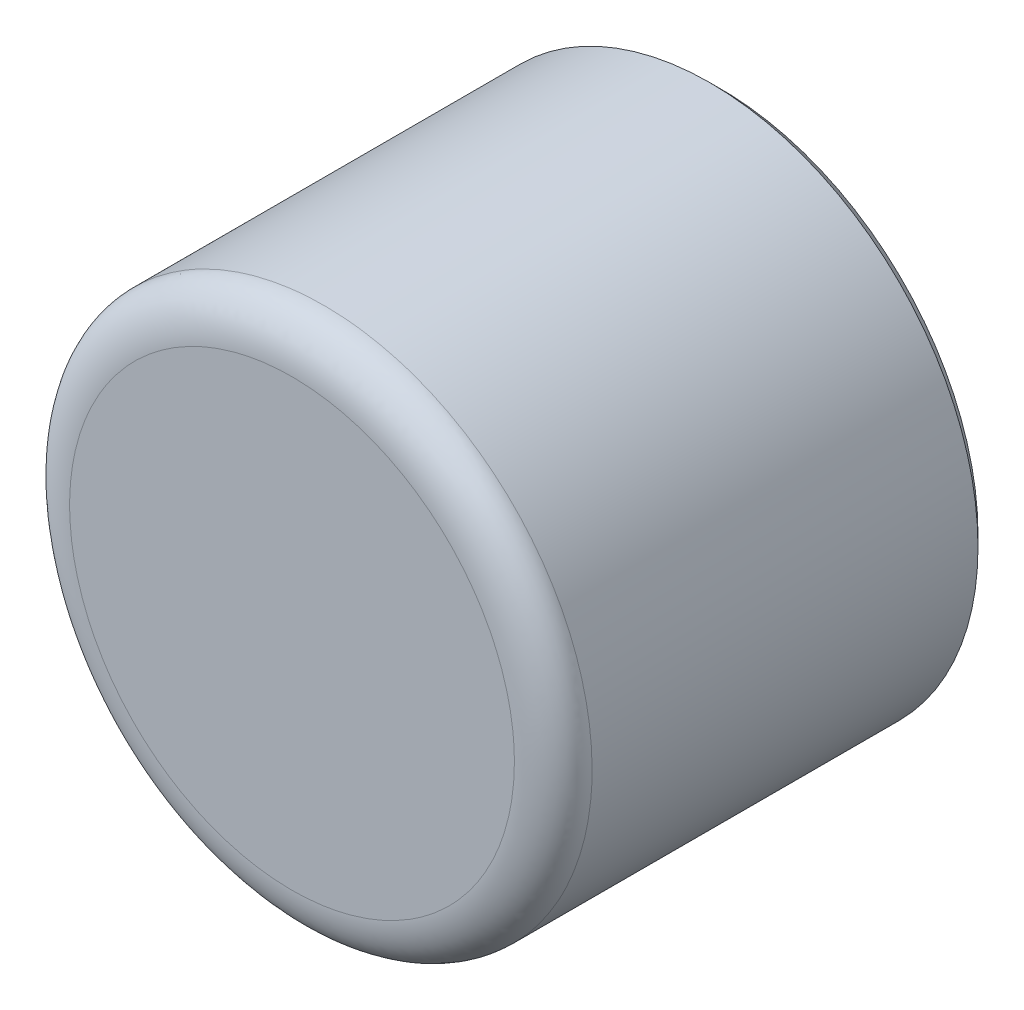
from build123d import *

# Parameters (mm, degrees)
SKETCH_1_R               = 10
EXTRUDE_1_DEPTH          = 16
FILLET_1_SIZE            = 1.2
FILLET_1_SIZE_2          = 1.7
SKETCH_2_R               = 3.15
CUT_EXTRUDE_1_DEPTH      = 11
EXTRUDE_2_REACH          = 23.354
PATTERN_CIRCULAR_1_COUNT = 18
SKETCH_4_R               = 8.5
SKETCH_4_R_2             = 4.5
CUT_EXTRUDE_2_DEPTH      = 14
FILLET_2_R               = 2
CHAMFER_1_SIZE           = 0.4
CHAMFER_2_SIZE           = 0.4


# Some blends are built 0.0001 mm under size
with BuildPart() as part:
    # Эскиз1 → Бобышка-Вытянуть1 (new body)
    with BuildSketch(Plane.XY):
        Circle(SKETCH_1_R)
    extrude(amount=EXTRUDE_1_DEPTH)

    # Скругление1
    # an asymmetric fillet: 1.7, 1.2 mm, written as the material it takes off along each edge
    with BuildSketch(Plane(origin=(0, 0, 16), x_dir=(1, 0, 0), z_dir=(0, -1, 0))) as fillet_1_piece_1:
        with BuildLine():
            Bezier((10, -FILLET_1_SIZE), (10, 0), (10 - FILLET_1_SIZE_2, 0), weights=[1, 0.707106781, 1])
            Line((10 - FILLET_1_SIZE_2, 0), (10, 0))
            Line((10, 0), (10, -FILLET_1_SIZE))
        make_face()
    revolve(axis=Axis((0, 0, 16), (0, 0, 1)), mode=Mode.SUBTRACT)

    # Эскиз2 → Вырез-Вытянуть1 (cut)
    with BuildSketch(Plane(origin=(0, 0, 0), x_dir=(-1, 0, 0), z_dir=(0, 0, -1))):
        Circle(SKETCH_2_R)
    extrude(amount=-CUT_EXTRUDE_1_DEPTH, mode=Mode.SUBTRACT)

    # Эскиз3 → Бобышка-Вытянуть2 (add, up to next)
    with BuildSketch(Plane(origin=(0, 0, 0), x_dir=(-1, 0, 0), z_dir=(0, 0, -1)), mode=Mode.PRIVATE) as extrude_2_sk1:
        Polygon((-0.5, 3.15), (0, 2.65), (0.5, 3.15), (0, 3.65), align=None)
    extrude_2_tool1 = extrude(extrude_2_sk1.sketch, amount=-EXTRUDE_2_REACH, mode=Mode.PRIVATE) - part.part
    extrude_2 = extrude_2_tool1.solids().sort_by_distance((0, 3.15, 0))[0]
    add(extrude_2)

    # Круговой массив1: Бобышка-Вытянуть2 ×18 about axis
    pattern_circular_1_axis = Axis((0, 0, 0), (0, 0, 1))
    for i in range(1, PATTERN_CIRCULAR_1_COUNT):
        add(extrude_2.rotate(pattern_circular_1_axis, i * 360 / PATTERN_CIRCULAR_1_COUNT))

    # Эскиз4 → Вырез-Вытянуть2 (cut)
    with BuildSketch(Plane(origin=(0, 0, 0), x_dir=(-1, 0, 0), z_dir=(0, 0, -1))):
        Circle(SKETCH_4_R)
        Circle(SKETCH_4_R_2, mode=Mode.SUBTRACT)
    extrude(amount=-CUT_EXTRUDE_2_DEPTH, mode=Mode.SUBTRACT)

    # Скругление2
    fillet_2_edges = [part.edges().sort_by_distance(p)[0] for p in [
        (8.5, 0, 14),
        (4.5, 0, 14),
    ]]
    fillet(fillet_2_edges, radius=FILLET_2_R - 0.0001)  # a hair under: the kernel refuses the full size

    # Фаска1
    chamfer_1_edges = [part.edges().sort_by_distance(p)[0] for p in [
        (-10, 0, 0),
        (8.5, 0, 0),
    ]]
    chamfer(chamfer_1_edges, length=CHAMFER_1_SIZE)

    # Фаска2
    chamfer_2_edges = [part.edges().sort_by_distance(p)[0] for p in [
        (2.031240648, -2.058701237, 0),
        (1.674703703, -2.357871256, 0),
        (0.54699176, -3.102144422, 0),
        (1.204624555, -2.629271579, 0),
        (0.767267246, -2.788456621, 0),
        (-0.54699176, -3.102144422, 0),
        (0.232712963, -2.882712963, 0),
        (-0.232712963, -2.882712963, 0),
        (-1.575, -2.727980022, 0),
        (-0.767267246, -2.788456621, 0),
        (-1.204624555, -2.629271579, 0),
        (-2.413039996, -2.024780971, 0),
        (-1.674703703, -2.357871256, 0),
        (-2.031240648, -2.058701237, 0),
        (-2.960031755, -1.077363451, 0),
        (-2.380146176, -1.64289182, 0),
        (-2.61285914, -1.239821144, 0),
        (-3.15, 0, 0),
        (-2.798507894, -0.729755384, 0),
        (-2.879328258, -0.271400322, 0),
        (-2.960031755, 1.077363451, 0),
        (-2.879328258, 0.271400322, 0),
        (-2.798507894, 0.729755384, 0),
        (-2.413039996, 2.024780971, 0),
        (-2.61285914, 1.239821144, 0),
        (-2.380146176, 1.64289182, 0),
        (-1.575, 2.727980022, 0),
        (-2.031240648, 2.058701237, 0),
        (-1.674703703, 2.357871256, 0),
        (0.54699176, 3.102144422, 0),
        (-0.54699176, 3.102144422, 0),
        (-1.204624555, 2.629271579, 0),
        (-0.767267246, 2.788456621, 0),
        (0.232712963, 2.882712963, 0),
        (-0.232712963, 2.882712963, 0),
        (4.5, 0, 0),
        (1.575, 2.727980022, 0),
        (0.767267246, 2.788456621, 0),
        (1.204624555, 2.629271579, 0),
        (2.413039996, 2.024780971, 0),
        (1.674703703, 2.357871256, 0),
        (2.031240648, 2.058701237, 0),
        (2.960031755, 1.077363451, 0),
        (2.380146176, 1.64289182, 0),
        (2.61285914, 1.239821144, 0),
        (3.15, 0, 0),
        (2.798507894, 0.729755384, 0),
        (2.879328258, 0.271400322, 0),
        (2.960031755, -1.077363451, 0),
        (2.879328258, -0.271400322, 0),
        (2.798507894, -0.729755384, 0),
        (2.413039996, -2.024780971, 0),
        (2.61285914, -1.239821144, 0),
        (2.380146176, -1.64289182, 0),
        (1.575, -2.727980022, 0),
    ]]
    chamfer(chamfer_2_edges, length=CHAMFER_2_SIZE)


solid = part.part
